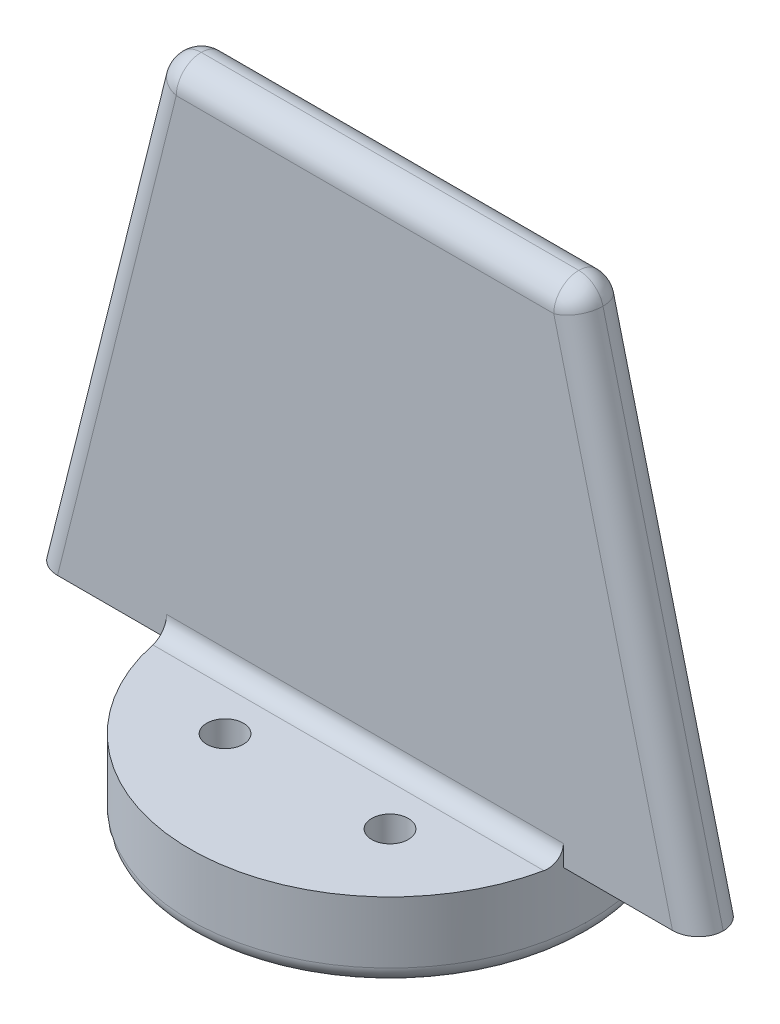
from build123d import *

# Parameters (mm, degrees)
FILLET1_R                = 1.5
BOSS_EXTRUDE1_DEPTH      = 4.45
BOSS_EXTRUDE1_DEPTH_BACK = 0.25
SKETCH3_R                = 12
FILLET2_R                = 1
SKETCH4_R                = 10
CUT_EXTRUDE1_DEPTH       = 2.45
SKETCH8_R                = 1.1
CUT_EXTRUDE2_DEPTH       = 38.80294317
CIRPATTERN1_COUNT        = 4


with BuildPart() as part:
    # Sketch1 → Loft1 section 0
    with BuildSketch(Plane(origin=(0, 0, 0), x_dir=(1, 0, 0), z_dir=(0, 1, 0))):
        with BuildLine():
            Line((-20, 1.5), (20, 1.5))
            Line((20, 1.5), (20, -1.5))
            Line((20, -1.5), (-20, -1.5))
            Line((-20, -1.5), (-20, 1.5))
        make_face()
    # Sketch2 → Loft1 section 1
    with BuildSketch(Plane(origin=(0, 30, 0), x_dir=(1, 0, 0), z_dir=(0, 1, 0))):
        with BuildLine():
            Line((-12.5, 1.5), (12.5, 1.5))
            Line((12.5, 1.5), (12.5, -1.5))
            Line((12.5, -1.5), (-12.5, -1.5))
            Line((-12.5, -1.5), (-12.5, 1.5))
        make_face()
    loft()

    # Fillet1
    fillet1_edges = [part.edges().sort_by_distance(p)[0] for p in [
        (0, 30, -1.5),
        (-12.5, 30, 0),
        (0, 30, 1.5),
        (12.5, 30, 0),
        (16.25, 15, 1.5),
        (-16.25, 15, 1.5),
        (16.25, 15, -1.5),
        (-16.25, 15, -1.5),
    ]]
    fillet(fillet1_edges, radius=FILLET1_R - 0.0001)  # a hair under: the kernel refuses the full size

    # Sketch3 → Boss-Extrude1 (add, two sides: drawn at the far end of the back side and taken through both)
    with BuildSketch(Plane.XZ.offset(-BOSS_EXTRUDE1_DEPTH_BACK)):
        with Locations(Location((0, 0, 0), (0, 0, 270))):
            Circle(SKETCH3_R)
    extrude(amount=BOSS_EXTRUDE1_DEPTH + BOSS_EXTRUDE1_DEPTH_BACK)

    # Fillet2
    fillet2_edges = [part.edges().sort_by_distance(p)[0] for p in [
        (0, 0.25, 1.5),
        (0, 0.25, -1.5),
        (0, -4.45, 12),
    ]]
    fillet(fillet2_edges, radius=FILLET2_R)

    # Sketch4 → Cut-Extrude1 (cut)
    with BuildSketch(Plane.XZ.offset(4.45)):
        with Locations(Location((0, 0, 0), (0, 0, 270))):
            Circle(SKETCH4_R)
    extrude(amount=-CUT_EXTRUDE1_DEPTH, mode=Mode.SUBTRACT)

    # Sketch8 → Cut-Extrude2 (cut, through all)
    with BuildSketch(Plane(origin=(0, 0.25, 0), x_dir=(1, 0, 0), z_dir=(0, 1, 0))):
        with Locations(Location((4.949747468, 4.949747468, 0), (0, 0, 270))):
            Circle(SKETCH8_R)
    cut_extrude2 = extrude(amount=-CUT_EXTRUDE2_DEPTH, mode=Mode.SUBTRACT)

    # CirPattern1: Cut-Extrude2 ×4 about axis
    cirpattern1_axis = Axis((0, 0, 0), (0, 1, 0))
    for i in range(1, CIRPATTERN1_COUNT):
        add(cut_extrude2.rotate(cirpattern1_axis, i * 360 / CIRPATTERN1_COUNT), mode=Mode.SUBTRACT)


solid = part.part
